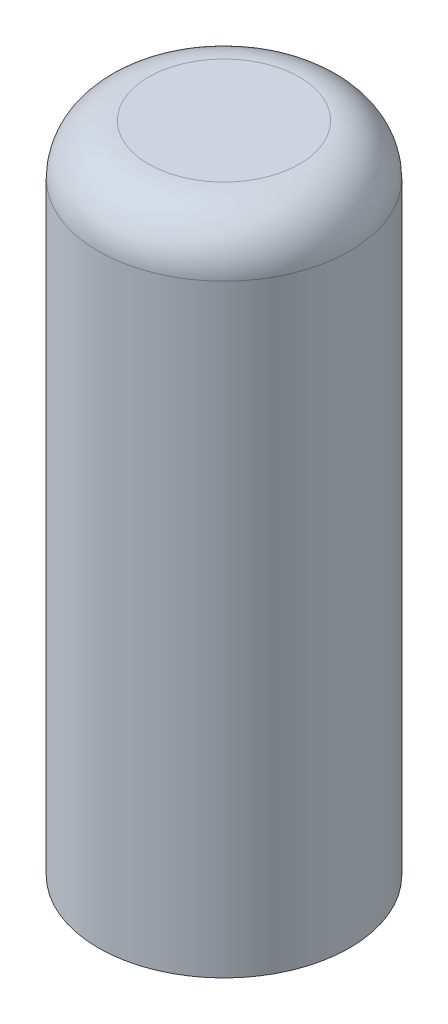
from build123d import *

# Parameters (mm, degrees)
SKETCH2_R           = 2.5
SKETCH2_R_2         = 0.5
BOSS_EXTRUDE1_DEPTH = 6.5
FILLET1_R           = 1
BOSS_EXTRUDE4_START = -1
SKETCH3_R           = 0.5
BOSS_EXTRUDE4_DEPTH = 1


with BuildPart() as part:
    # Sketch2 → Boss-Extrude1 (new, symmetric)
    with BuildSketch(Plane(origin=(0, 0, 0), x_dir=(1, 0, 0), z_dir=(0, 1, 0))):
        Circle(SKETCH2_R)
        Circle(SKETCH2_R_2, mode=Mode.SUBTRACT)
    extrude(amount=BOSS_EXTRUDE1_DEPTH, both=True)

    # Fillet1
    fillet1_edges = [part.edges().sort_by_distance(p)[0] for p in [
        (-2.5, 6.5, 0),
    ]]
    fillet(fillet1_edges, radius=FILLET1_R)

    # Sketch3 → Boss-Extrude4 (add)
    with BuildSketch(Plane(origin=(0, 6.5, 0), x_dir=(1, 0, 0), z_dir=(0, 1, 0)).offset(BOSS_EXTRUDE4_START)):
        Circle(SKETCH3_R)
    extrude(amount=BOSS_EXTRUDE4_DEPTH)


solid = part.part
